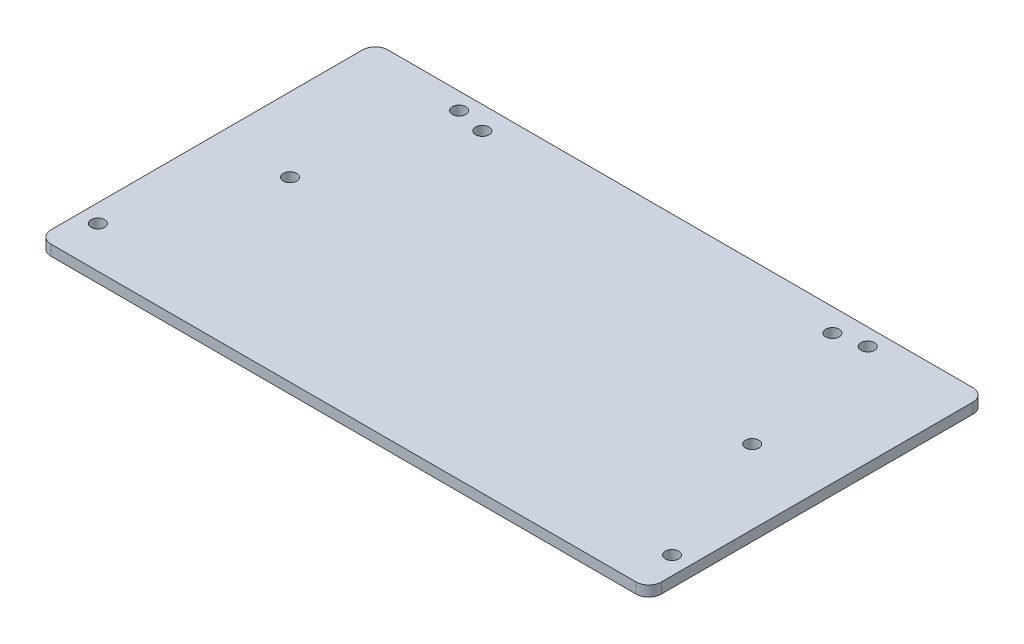
from build123d import *

# Parameters (mm, degrees)
SKETCH1_W           = 184.15
SKETCH1_H           = 101.6
BOSS_EXTRUDE1_DEPTH = 3.175
FILLET1_R           = 3.81
SKETCH2_R           = 2.032
CUT_EXTRUDE1_DEPTH  = 211.342252353


with BuildPart() as part:
    # Sketch1 → Boss-Extrude1 (new body)
    with BuildSketch(Plane(origin=(0, 0, 0), x_dir=(1, 0, 0), z_dir=(0, 1, 0))):
        with Locations((92.075, -50.8)):
            Rectangle(SKETCH1_W, SKETCH1_H)
    extrude(amount=BOSS_EXTRUDE1_DEPTH)

    # Fillet1
    fillet1_edges = [part.edges().sort_by_distance(p)[0] for p in [
        (184.15, 1.5875, 0),
        (184.15, 1.5875, 101.6),
        (0, 1.5875, 0),
        (0, 1.5875, 101.6),
    ]]
    fillet(fillet1_edges, radius=FILLET1_R)

    # Sketch2 → Cut-Extrude1 (cut, through all)
    with BuildSketch(Plane(origin=(0, 3.175, 0), x_dir=(1, 0, 0), z_dir=(0, 1, 0))):
        with Locations((5.437401114, -89.146320086)):
            Circle(SKETCH2_R)
        with Locations((22.338907609, -48.03498858)):
            Circle(SKETCH2_R)
        with Locations((39.240414104, -6.923657075)):
            Circle(SKETCH2_R)
        with Locations((30.40630044, -5.111422056)):
            Circle(SKETCH2_R)
        with Locations((178.712598886, -89.146320086)):
            Circle(SKETCH2_R)
        with Locations((161.811092391, -48.03498858)):
            Circle(SKETCH2_R)
        with Locations((153.74369956, -5.111422056)):
            Circle(SKETCH2_R)
        with Locations((144.909585896, -6.923657075)):
            Circle(SKETCH2_R)
    extrude(amount=-CUT_EXTRUDE1_DEPTH, mode=Mode.SUBTRACT)


solid = part.part
